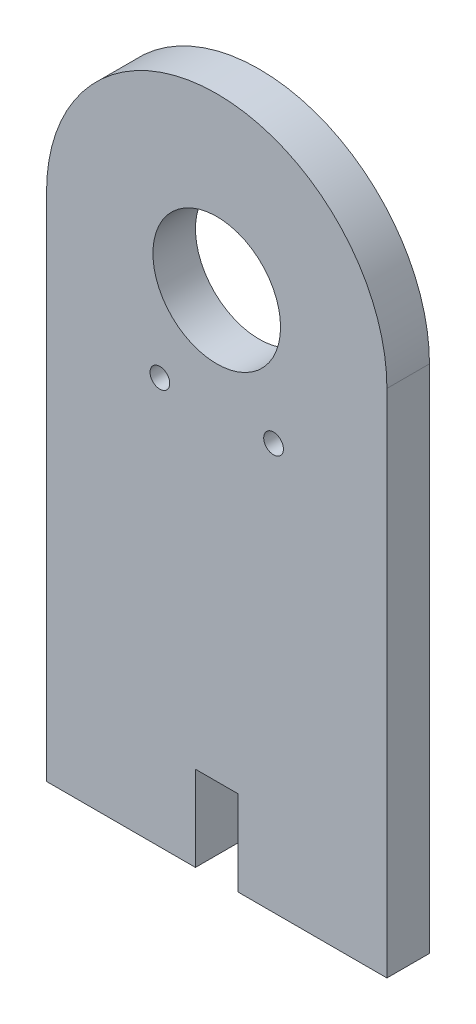
from build123d import *

# Parameters (mm, degrees)
BOSS_EXTRUDE1_DEPTH         = 6.35
SKETCH3_W                   = 6.35
SKETCH3_H                   = 12.7
CUT_EXTRUDE1_DEPTH          = 6.35
F_3_4_0_75_DIAMETER_HOLE1_D = 19.05
F_32_0_116_DIAMETER_HOLE1_D = 2.9464


with BuildPart() as part:
    # Sketch2 → Boss-Extrude1 (new body)
    with BuildSketch(Plane.XY):
        with BuildLine():
            Line((0, 0), (50.8, 0))
            Line((50.8, 0), (50.8, 76.2))
            ThreePointArc((50.8, 76.2), (25.4, 101.6), (0, 76.2))
            Line((0, 76.2), (0, 0))
        make_face()
    extrude(amount=BOSS_EXTRUDE1_DEPTH)

    # Sketch3 → Cut-Extrude1 (cut)
    with BuildSketch(Plane.XY.offset(6.35)):
        with Locations((25.4, 6.35)):
            Rectangle(SKETCH3_W, SKETCH3_H)
    extrude(amount=-CUT_EXTRUDE1_DEPTH, mode=Mode.SUBTRACT)

    # 3/4 (0.75) Diameter Hole1 (through all)
    with Locations(Plane(origin=(25.4, 76.2, 6.35), x_dir=(1, 0, 0), z_dir=(0, 0, 1))):
        with Locations((0, 0)):
            Hole(F_3_4_0_75_DIAMETER_HOLE1_D / 2)

    # #32 (0.116) Diameter Hole1 (through all)
    with Locations(Plane.XY.offset(6.35)):
        with Locations((16.9164, 60.6298), (33.8836, 60.6298)):
            Hole(F_32_0_116_DIAMETER_HOLE1_D / 2)


solid = part.part
